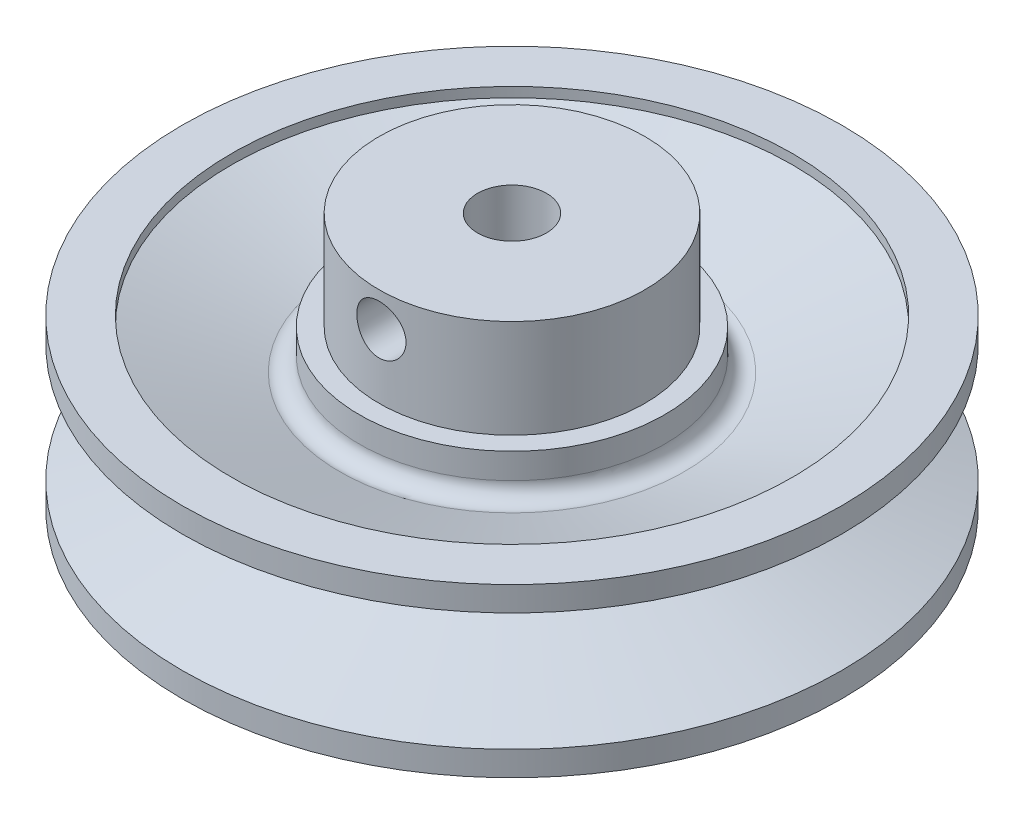
from build123d import *

# Parameters (mm, degrees)
CUT_EXTRUDE1_START = 4.898979378
CUT_EXTRUDE1_DEPTH = 22.101020701


# Read off the part's stored shape, not the designer's step: Cut-Extrude1
with BuildPart() as part:
    # Sketch1 → Revolve1 (revolve)
    with BuildSketch(Plane.XY, mode=Mode.PRIVATE) as revolve1_sk:
        with BuildLine():
            Line((-7, 50), (-27, 50))
            Line((-27, 50), (-27, 30))
            Line((-27, 30), (-31, 30))
            Line((-31, 30), (-31, 24.821217929))
            ThreePointArc((-31, 24.821217929), (-32.279270691, 22.363761796), (-35.02606043, 22.002140067))
            Line((-35.02606043, 22.002140067), (-57, 30))
            Line((-57, 30), (-57, 32))
            Line((-57, 32), (-67, 32))
            Line((-67, 32), (-67, 27))
            Line((-67, 27), (-43.97393957, 18.619199391))
            ThreePointArc((-43.97393957, 18.619199391), (-42.542543867, 17.520850838), (-42, 15.800121529))
            Line((-42, 15.800121529), (-42, 14.199878471))
            ThreePointArc((-42, 14.199878471), (-42.542543867, 12.479149162), (-43.97393957, 11.380800609))
            Line((-43.97393957, 11.380800609), (-67, 3))
            Line((-67, 3), (-67, -2))
            Line((-67, -2), (-57, -2))
            Line((-57, -2), (-57, 0))
            Line((-57, 0), (-35.02606043, 7.997859933))
            ThreePointArc((-35.02606043, 7.997859933), (-32.279270691, 7.636238204), (-31, 5.178782071))
            Line((-31, 5.178782071), (-31, 0))
            Line((-31, 0), (-7, 0))
            Line((-7, 0), (-7, 50))
        make_face()
    revolve(revolve1_sk.sketch.rotate(Axis((0, 0, 0), (0, 1, 0)), 270), axis=Axis((0, 0, 0), (0, 1, 0)))

    # Cut-Extrude1 outline → Cut-Extrude1 (cut)
    with BuildSketch(Plane.XY.offset(CUT_EXTRUDE1_START)):
        with BuildLine():
            add(Edge.make_bspline(
                [(-5, 43), (-5, 41.67563617), (-4.455498311, 40.384216944), (-2.614748823, 38.543894661), (-1.310387974, 38.000764057), (1.304550701, 37.999237646), (2.604262767, 38.533632867), (4.465141201, 40.393635869), (4.999476778, 41.691327392), (5.000522421, 44.30467144), (4.459732186, 45.609641922), (2.617817368, 47.4549382), (1.324771948, 47.999010031), (-1.31728863, 48.000987169), (-2.612604689, 47.457113982), (-4.45328192, 45.61913124), (-5, 44.32436383), (-5, 43)],
                knots=[0, 0, 0, 0, 0.125, 0.125, 0.25, 0.25, 0.375, 0.375, 0.5, 0.5, 0.625, 0.625, 0.75, 0.75, 0.875, 0.875, 1, 1, 1, 1], degree=3))
        make_face()
    extrude(amount=CUT_EXTRUDE1_DEPTH, mode=Mode.SUBTRACT)


solid = part.part
